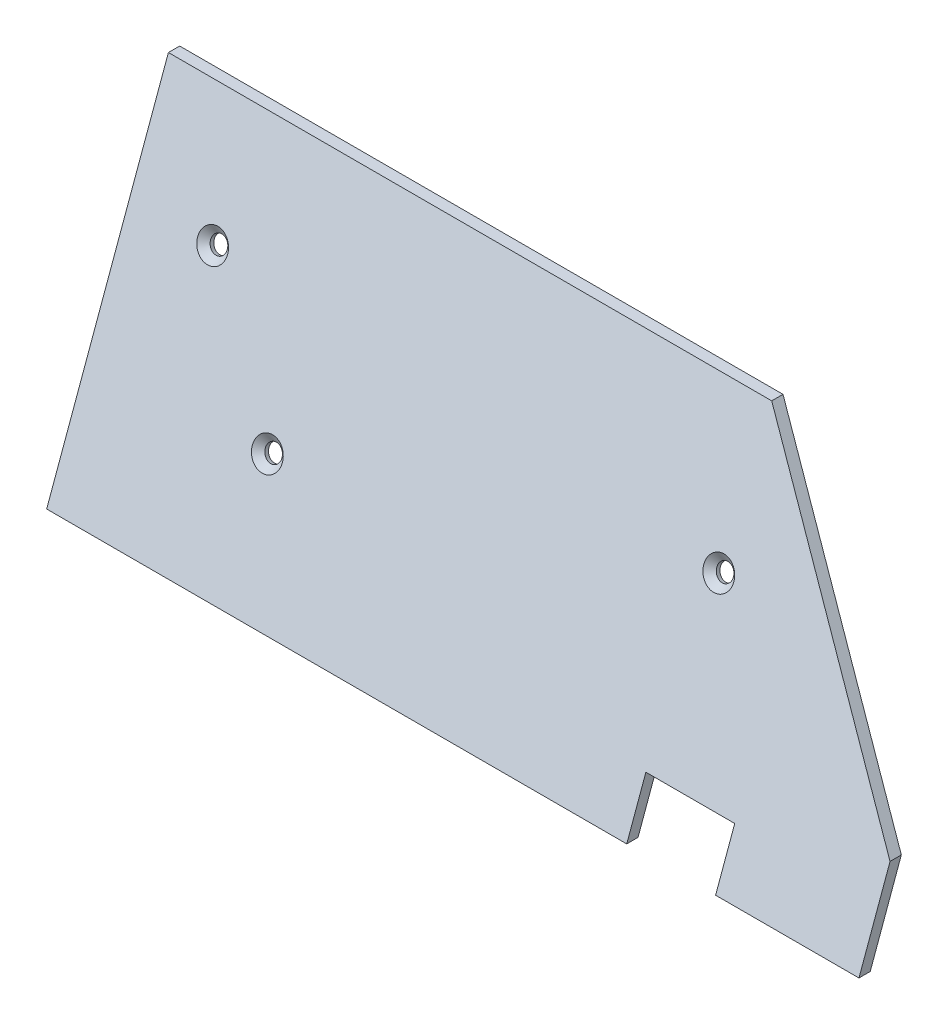
from build123d import *

# Parameters (mm, degrees)
MAIN_DEPTH                                      = 85
BACKBRACKETHOLES_D                              = 3.5
BACKBRACKETHOLES_DEPTH                          = 5
BACKBRACKETHOLES_CSINK_D                        = 6.3
BACKBRACKETHOLES_CSINK_ANGLE                    = 90
CUT_EXTRUDE1_DEPTH                              = 28.6
CSK_FOR_M3_FLAT_HEAD_MACHINE_SCREW1_D           = 3.5
CSK_FOR_M3_FLAT_HEAD_MACHINE_SCREW1_DEPTH       = 5
CSK_FOR_M3_FLAT_HEAD_MACHINE_SCREW1_CSINK_D     = 6.3
CSK_FOR_M3_FLAT_HEAD_MACHINE_SCREW1_CSINK_ANGLE = 90
CUT_EXTRUDE3_REACH                              = 145.023
CUT_EXTRUDE3_START                              = 30
SKETCH7_W                                       = 18.6
SKETCH7_H                                       = 12


with BuildPart() as part:
    # Sketch1 → Main (new, symmetric)
    with BuildSketch(Plane(origin=(0, 0, 0), x_dir=(0, 0, -1), z_dir=(1, 0, 0))):
        Polygon((0, 0), (-2.3622, 0), (23.115716399, 70), (25.477916399, 70), align=None)
    extrude(amount=MAIN_DEPTH, both=True)

    # BackBracketHoles
    with Locations(Plane(origin=(0, 0.759196446, 2.085875092), x_dir=(1, 0, 0), z_dir=(0, 0.3420201433256726, 0.9396926207859071))):
        with Locations((-67.6378, 50.002080017), (-47.6378, 25.002080017)):
            CounterSinkHole(BACKBRACKETHOLES_D / 2, BACKBRACKETHOLES_CSINK_D / 2, depth=BACKBRACKETHOLES_DEPTH, counter_sink_angle=BACKBRACKETHOLES_CSINK_ANGLE)

    # Sketch4 → Cut-Extrude1 (cut)
    with BuildSketch(Plane.XY):
        Polygon((41.263025818, 70), (100, 0), (100, 70), align=None)
    extrude(amount=-CUT_EXTRUDE1_DEPTH, mode=Mode.SUBTRACT)

    # CSK for M3 Flat Head Machine Screw1
    with Locations(Plane(origin=(0, 0.759196446, 2.085875092), x_dir=(1, 0, 0), z_dir=(0, 0.3420201433256726, 0.9396926207859071))):
        with Locations((40, 45.002080017)):
            CounterSinkHole(CSK_FOR_M3_FLAT_HEAD_MACHINE_SCREW1_D / 2, CSK_FOR_M3_FLAT_HEAD_MACHINE_SCREW1_CSINK_D / 2, depth=CSK_FOR_M3_FLAT_HEAD_MACHINE_SCREW1_DEPTH, counter_sink_angle=CSK_FOR_M3_FLAT_HEAD_MACHINE_SCREW1_CSINK_ANGLE)

    # Cut-Extrude3: up to this plane
    cut_extrude3_end = Plane(origin=(85, 70, -25.477916399), z_dir=(0, 0.3420201433256726, 0.939692620785907))
    # Sketch7 → Cut-Extrude3 (cut, up to the surface)
    with BuildSketch(Plane.XY.offset(CUT_EXTRUDE3_START), mode=Mode.PRIVATE) as cut_extrude3_sk1:
        with Locations((45.7, 5.001954577)):
            Rectangle(SKETCH7_W, SKETCH7_H)
    cut_extrude3_tool1 = split(extrude(cut_extrude3_sk1.sketch, amount=-CUT_EXTRUDE3_REACH, mode=Mode.PRIVATE), bisect_by=cut_extrude3_end, keep=Keep.BOTH, mode=Mode.PRIVATE)
    add(cut_extrude3_tool1.solids().sort_by_distance((45.7, 5.001955, 30))[0], mode=Mode.SUBTRACT)


solid = part.part
